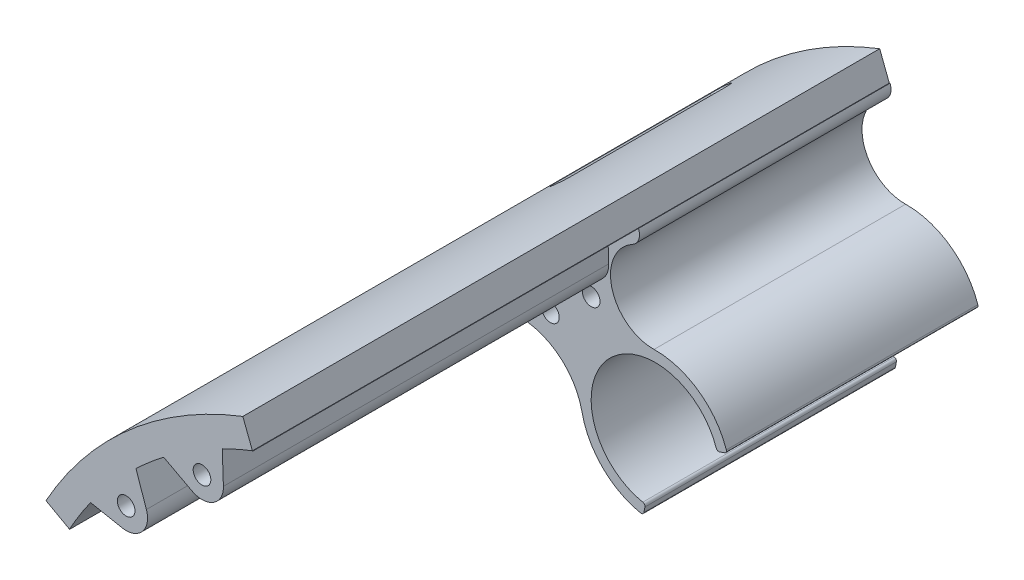
from build123d import *

# Parameters (mm, degrees)
BOSS_EXTRUDE1_DEPTH     = 119
BOSS_EXTRUDE2_DEPTH     = 47
SKETCH4_R               = 1.65
CUT_EXTRUDE1_DEPTH      = 151.148950374
CUT_EXTRUDE2_START      = 44
CUT_EXTRUDE2_DEPTH      = 2.6
BOSS_EXTRUDE3_DEPTH     = 119
SKETCH7_R               = 1.65
CUT_EXTRUDE3_DEPTH      = 151.148950374
CUT_EXTRUDE4_START      = 116
CUT_EXTRUDE4_DEPTH      = 2.6
CUT_EXTRUDE5_START      = 3
CUT_EXTRUDE5_DEPTH      = 2.6
CUT_EXTRUDE_THIN1_DEPTH = 151.148950374
CUT_EXTRUDE6_START      = 7
CUT_EXTRUDE6_DEPTH      = 33
FILLET1_R               = 2


with BuildPart() as part:
    # Sketch1 → Boss-Extrude1 (new body)
    with BuildSketch(Plane(origin=(0, 0, 0), x_dir=(0, 1, 0), z_dir=(0, 0, 1))):
        with BuildLine():
            Line((66.793011614, 25.63943495), (62.125109481, 23.847595202))
            ThreePointArc((62.125109481, 23.847595202), (50.18784505, 43.696878999), (32.170193606, 58.252173078))
            Line((32.170193606, 58.252173078), (34.587369472, 62.629073903))
            ThreePointArc((34.587369472, 62.629073903), (53.95881545, 46.980136869), (66.793011614, 25.63943495))
        make_face()
    extrude(amount=BOSS_EXTRUDE1_DEPTH)

    # Sketch3 → Boss-Extrude2 (add)
    with BuildSketch(Plane(origin=(0, 0, 0), x_dir=(0, 1, 0), z_dir=(0, 0, 1))):
        with BuildLine():
            Line((16.662914887, 22.849921086), (17.643603591, 22.654345869))
            ThreePointArc((17.643603591, 22.654345869), (18.018970735, 22.728818123), (18.231735551, 23.046902612))
            ThreePointArc((18.231735551, 23.046902612), (37.916609506, 29.718164665), (33.851654942, 9.334932723))
            ThreePointArc((33.851654942, 9.334932723), (33.563813587, 9.082754287), (33.538596095, 8.700902631))
            Line((33.538596095, 8.700902631), (33.85956734, 7.753813691))
            ThreePointArc((33.85956734, 7.753813691), (34.111745776, 7.465972336), (34.493597433, 7.440754844))
            ThreePointArc((34.493597433, 7.440754844), (41.448499021, 12.641968592), (43.997873295, 20.944014808))
            ThreePointArc((43.997873295, 20.944014808), (49.930251766, 28.811968202), (58.997685125, 24.954578252))
            ThreePointArc((58.997685125, 24.954578252), (60.351321071, 23.807583941), (62.125109481, 23.847595202))
            ThreePointArc((62.125109481, 23.847595202), (50.18784505, 43.696878999), (32.170193606, 58.252173078))
            ThreePointArc((32.170193606, 58.252173078), (31.867825608, 56.602303211), (32.676329677, 55.132671232))
            ThreePointArc((32.676329677, 55.132671232), (36.307290349, 43.066223982), (27.152640183, 34.407390053))
            ThreePointArc((27.152640183, 34.407390053), (20.061145201, 30.559977956), (16.270358143, 23.438053047))
            ThreePointArc((16.270358143, 23.438053047), (16.344830398, 23.062685903), (16.662914887, 22.849921086))
        make_face()
    extrude(amount=BOSS_EXTRUDE2_DEPTH)

    # Sketch4 → Cut-Extrude1 (cut, through all)
    with BuildSketch(Plane(origin=(0, 0, 0), x_dir=(0, 1, 0), z_dir=(0, 0, 1))):
        with Locations(Location((40.305086528, 40.305086528, 0), (0, 0, 270))):
            Circle(SKETCH4_R)
        with Locations(Location((46.691666524, 32.693856872, 0), (0, 0, 270))):
            Circle(SKETCH4_R)
    extrude(amount=CUT_EXTRUDE1_DEPTH, mode=Mode.SUBTRACT)

    # Sketch5 → Cut-Extrude2 (cut)
    with BuildSketch(Plane(origin=(0, 0, 0), x_dir=(0, 1, 0), z_dir=(0, 0, 1)).offset(CUT_EXTRUDE2_START)):
        Polygon((43.480513008, 40.305086528), (41.892799768, 43.055086528), (38.717373287, 43.055086528), (37.129660047, 40.305086528), (38.717373287, 37.555086528), (41.892799768, 37.555086528), align=None)
        Polygon((49.867093005, 32.693856872), (48.279379765, 35.443856872), (45.103953284, 35.443856872), (43.516240044, 32.693856872), (45.103953284, 29.943856872), (48.279379765, 29.943856872), align=None)
    extrude(amount=-CUT_EXTRUDE2_DEPTH, mode=Mode.SUBTRACT)

    # Sketch6 → Boss-Extrude3 (add)
    with BuildSketch(Plane(origin=(0, 0, 0), x_dir=(0, 1, 0), z_dir=(0, 0, 1))):
        with BuildLine():
            ThreePointArc((38.577322779, 54.222017596), (43.657448084, 50.222149016), (48.32540701, 45.748137255))
            Line((48.32540701, 45.748137255), (42.663514101, 43.798591183))
            ThreePointArc((42.663514101, 43.798591183), (38.737005367, 44.561827164), (37.434732749, 48.343901467))
            Line((37.434732749, 48.343901467), (38.577322779, 54.222017596))
        make_face()
        with BuildLine():
            ThreePointArc((52.744660964, 40.57385568), (56.433360559, 35.263477438), (59.589277435, 29.620179604))
            Line((59.589277435, 29.620179604), (53.604790209, 29.411196706))
            ThreePointArc((53.604790209, 29.411196706), (50.072999838, 31.289082957), (49.933401851, 35.286646265))
            Line((49.933401851, 35.286646265), (52.744660964, 40.57385568))
        make_face()
    extrude(amount=BOSS_EXTRUDE3_DEPTH)

    # Sketch7 → Cut-Extrude3 (cut, through all)
    with BuildSketch(Plane(origin=(0, 0, 0), x_dir=(0, 1, 0), z_dir=(0, 0, 1))):
        with Locations(Location((41.361241483, 47.580665485, 0), (0, 0, 270))):
            Circle(SKETCH7_R)
        with Locations(Location((53.465192222, 33.408760014, 0), (0, 0, 270))):
            Circle(SKETCH7_R)
    extrude(amount=CUT_EXTRUDE3_DEPTH, mode=Mode.SUBTRACT)

    # Sketch8 → Cut-Extrude4 (cut)
    with BuildSketch(Plane(origin=(0, 0, 0), x_dir=(0, 1, 0), z_dir=(0, 0, 1)).offset(CUT_EXTRUDE4_START)):
        Polygon((44.536667963, 47.580665485), (42.948954723, 50.330665485), (39.773528242, 50.330665485), (38.185815002, 47.580665485), (39.773528242, 44.830665485), (42.948954723, 44.830665485), align=None)
        Polygon((56.640618703, 33.408760014), (55.052905462, 36.158760014), (51.877478982, 36.158760014), (50.289765742, 33.408760014), (51.877478982, 30.658760014), (55.052905462, 30.658760014), align=None)
    extrude(amount=-CUT_EXTRUDE4_DEPTH, mode=Mode.SUBTRACT)

    # Sketch5<2> → Cut-Extrude5 (cut)
    with BuildSketch(Plane(origin=(0, 0, 0), x_dir=(0, 1, 0), z_dir=(0, 0, 1)).offset(CUT_EXTRUDE5_START)):
        Polygon((43.480513008, 40.305086528), (41.892799768, 43.055086528), (38.717373287, 43.055086528), (37.129660047, 40.305086528), (38.717373287, 37.555086528), (41.892799768, 37.555086528), align=None)
        Polygon((49.867093005, 32.693856872), (48.279379765, 35.443856872), (45.103953284, 35.443856872), (43.516240044, 32.693856872), (45.103953284, 29.943856872), (48.279379765, 29.943856872), align=None)
    extrude(amount=CUT_EXTRUDE5_DEPTH, mode=Mode.SUBTRACT)

    # Sketch9 → Cut-Extrude-Thin1 (cut, through all)
    with BuildSketch(Plane(origin=(0, 0, 0), x_dir=(0, 1, 0), z_dir=(0, 0, 1))):
        Polygon((62.178864674, 23.707558139), (66.846766806, 25.499397886), (66.739256421, 25.779472014), (62.071354289, 23.987632266), align=None)
        Polygon((32.301500631, 58.179657802), (34.718676497, 62.556558627), (34.456062447, 62.701589179), (32.038886581, 58.324688354), align=None)
    extrude(amount=CUT_EXTRUDE_THIN1_DEPTH, mode=Mode.SUBTRACT)

    # Sketch10 → Cut-Extrude6 (cut)
    with BuildSketch(Plane(origin=(0, 0, 0), x_dir=(0, 1, 0), z_dir=(0, 0, 1)).offset(CUT_EXTRUDE6_START)):
        Polygon((35.44701831, 29.64338025), (54.282655982, 50.303964956), (57.23861856, 47.609102207), (38.402980888, 26.948517501), align=None)
    extrude(amount=CUT_EXTRUDE6_DEPTH, mode=Mode.SUBTRACT)

    # Fillet1
    # the kernel refuses this fillet: 2 mm, written as the material it adds along each edge
    with BuildSketch(Plane(origin=(-27.096333376, 33.124951788, 40), x_dir=(0.673715687259404, 0.7389906445555241, 0), z_dir=(-0.7389906445555242, 0.673715687259404, 0))) as fillet1_piece_1_section:
        with BuildLine():
            CenterArc((FILLET1_R, FILLET1_R), FILLET1_R, 180, 90)
            Line((0, FILLET1_R), (0, 0))
            Line((0, 0), (FILLET1_R, 0))
        make_face()
    fillet1_piece_1 = extrude(amount=33.933040427, mode=Mode.PRIVATE)
    fillet1_piece_1 = fillet1_piece_1 & Plane(origin=(0, 0, 39.546220167), x_dir=(-0.8753801649783101, 0.4834351732782244, 0), z_dir=(0, 0, -1)) * Cylinder(71.545, 76, mode=Mode.PRIVATE)
    fillet1_piece_1 = fillet1_piece_1 - Plane(origin=(-20.7, 30, 39.546220167), x_dir=(-0.19557521764305516, -0.9806887040462288, 0), z_dir=(0, 0, -1)) * Cylinder(12, 76, mode=Mode.PRIVATE)
    add(fillet1_piece_1)
    with BuildSketch(Plane(origin=(-49.13548978, 58.630180498, 40), x_dir=(-0.6737156872594037, -0.7389906445555243, 0), z_dir=(0.7389906445555244, -0.6737156872594038, 0))) as fillet1_piece_2_section:
        with BuildLine():
            CenterArc((FILLET1_R, FILLET1_R), FILLET1_R, 180, 90)
            Line((0, FILLET1_R), (0, 0))
            Line((0, 0), (FILLET1_R, 0))
        make_face()
    fillet1_piece_2 = extrude(amount=33.470003085, mode=Mode.PRIVATE)
    fillet1_piece_2 = fillet1_piece_2 & Plane(origin=(0, 0, 39.547293042), x_dir=(-0.8753801649783101, 0.4834351732782244, 0), z_dir=(0, 0, -1)) * Cylinder(71.545, 75, mode=Mode.PRIVATE)
    fillet1_piece_2 = fillet1_piece_2 - Plane(origin=(-20.7, 30, 39.547293042), x_dir=(-0.19557521764305516, -0.9806887040462288, 0), z_dir=(0, 0, -1)) * Cylinder(12, 75, mode=Mode.PRIVATE)
    add(fillet1_piece_2)
    with BuildSketch(Plane(origin=(-27.096333376, 33.124951788, 7), x_dir=(0.673715687259404, 0.7389906445555241, 0), z_dir=(-0.7389906445555242, 0.673715687259404, 0))) as fillet1_piece_3_section:
        with BuildLine():
            CenterArc((FILLET1_R, -FILLET1_R), FILLET1_R, 90, 90)
            Line((0, -FILLET1_R), (0, 0))
            Line((0, 0), (FILLET1_R, 0))
        make_face()
    fillet1_piece_3 = extrude(amount=33.933040427, mode=Mode.PRIVATE)
    fillet1_piece_3 = fillet1_piece_3 & Plane(origin=(0, 0, 7.453779833), x_dir=(-0.8753801649783101, 0.4834351732782244, 0), z_dir=(0, 0, -1)) * Cylinder(71.545, 76, mode=Mode.PRIVATE)
    fillet1_piece_3 = fillet1_piece_3 - Plane(origin=(-20.7, 30, 7.453779833), x_dir=(-0.19557521764305516, -0.9806887040462288, 0), z_dir=(0, 0, -1)) * Cylinder(12, 76, mode=Mode.PRIVATE)
    add(fillet1_piece_3)
    with BuildSketch(Plane(origin=(-49.13548978, 58.630180498, 7), x_dir=(0, 0, 1), z_dir=(0.7389906445555244, -0.6737156872594038, 0))) as fillet1_piece_4_section:
        with BuildLine():
            CenterArc((FILLET1_R, FILLET1_R), FILLET1_R, 180, 90)
            Line((0, FILLET1_R), (0, 0))
            Line((0, 0), (FILLET1_R, 0))
        make_face()
    fillet1_piece_4 = extrude(amount=33.470003085, mode=Mode.PRIVATE)
    fillet1_piece_4 = fillet1_piece_4 & Plane(origin=(0, 0, 7.452710361), x_dir=(-0.8753801649783101, 0.4834351732782244, 0), z_dir=(0, 0, -1)) * Cylinder(71.545, 75, mode=Mode.PRIVATE)
    fillet1_piece_4 = fillet1_piece_4 - Plane(origin=(-20.7, 30, 7.452710361), x_dir=(-0.19557521764305516, -0.9806887040462288, 0), z_dir=(0, 0, -1)) * Cylinder(12, 75, mode=Mode.PRIVATE)
    add(fillet1_piece_4)


solid = part.part
